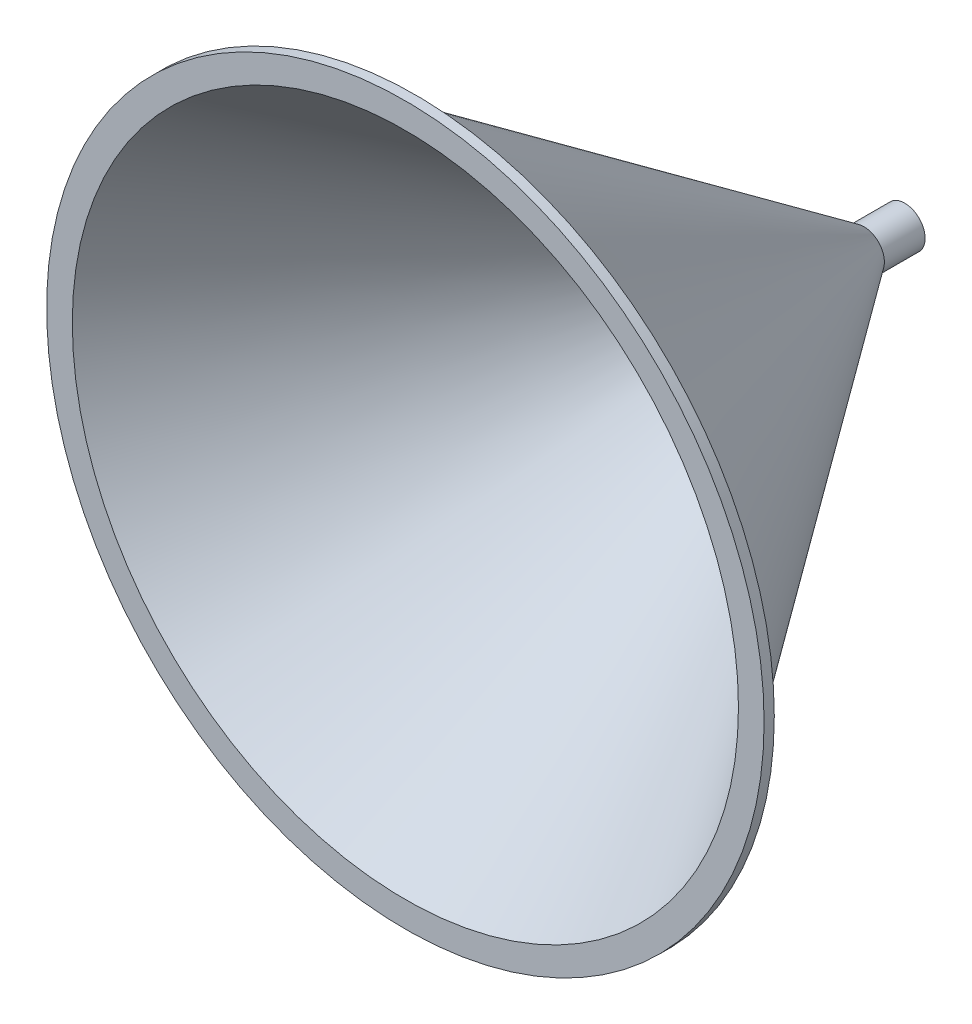
from build123d import *


# Read off the part's stored shape, not the designer's step: Vaciado1
with BuildPart() as part:
    # Croquis1 → Revolución2 (revolve)
    with BuildSketch(Plane(origin=(0, 0, 0), x_dir=(1, 0, 0), z_dir=(0, 1, 0)), mode=Mode.PRIVATE) as revoluci_n2_sk:
        Polygon((0, -60), (0, 60), (-5, 60), (-5, 50), (-83, -60), (-88, -60), (-88, -62.5), (0, -62.5), align=None)
    revolve(revoluci_n2_sk.sketch.rotate(Axis((0, 0, 60), (0, 0, -1)), 180), axis=Axis((0, 0, 60), (0, 0, -1)))

    # Vaciado1 outline → Vaciado1 (revolve, cut)
    with BuildSketch(Plane.XZ):
        Polygon((0, -60), (2.5, -60), (2.5, -49.203587736), (81.707998576, 62.5), (0, 62.5), align=None)
    revolve(axis=Axis((0, 0, 0), (0, 0, 1)), mode=Mode.SUBTRACT)


solid = part.part
